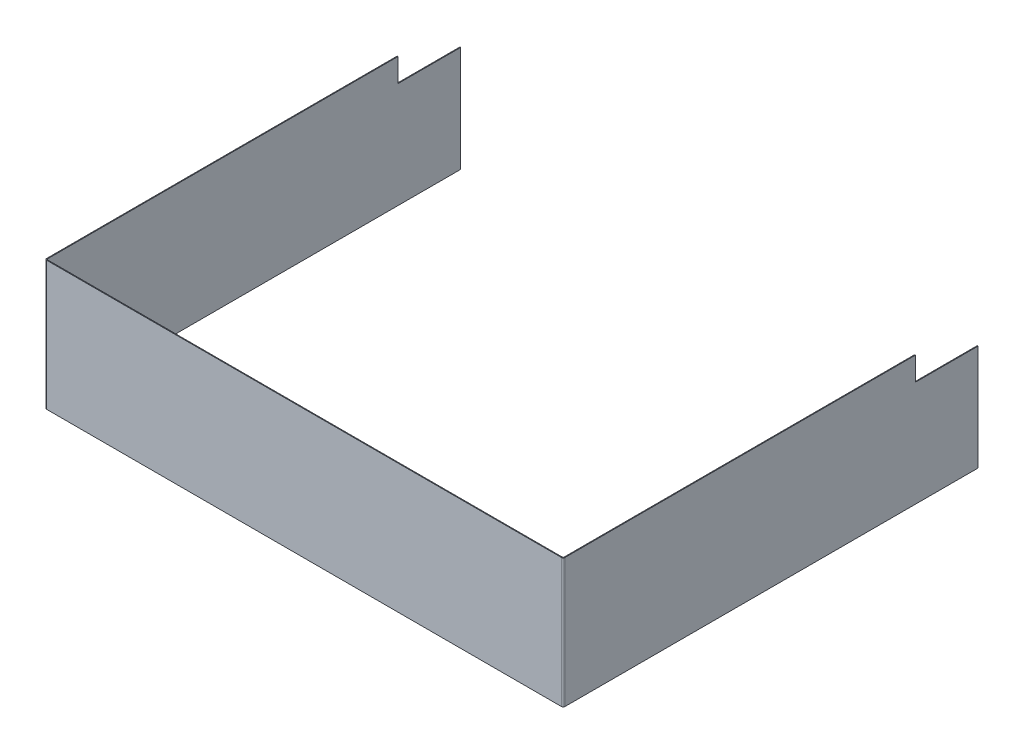
from build123d import *

# Parameters (mm, degrees)
SKETCH1_W                      = 660
SKETCH1_H                      = 165
BASE_FLANGE1_DEPTH             = 1
EDGE_FLANGE1_STRIP_W           = 6
EDGE_FLANGE1_STRIP_H           = 1
EDGE_FLANGE1_STRIP_CUT_DEPTH   = 165
EDGE_FLANGE1_STRIP_2_W         = 6
EDGE_FLANGE1_STRIP_2_H         = 1
EDGE_FLANGE1_STRIP_CUT_2_DEPTH = 165
EDGE_FLANGE1_DEPTH             = 165
EDGE_FLANGE1_BEND_DEPTH        = 165
SKETCH12_W                     = 80
SKETCH12_H                     = 30
CUT_EXTRUDE1_DEPTH             = 853.027141586


# Sheet-metal steps are written as plain solids
with BuildPart() as part:
    # Sketch1 → Base-Flange1 (new body)
    with BuildSketch(Plane.XY):
        Rectangle(SKETCH1_W, SKETCH1_H)
    extrude(amount=-BASE_FLANGE1_DEPTH)

    # Edge-Flange1 strip (across the edge) → Edge-Flange1 strip cut (cut)
    with BuildSketch(Plane(origin=(330, 82.5, -1), x_dir=(-1, 0, 0), z_dir=(0, -1, 0))):
        with Locations((-2, -0.5)):
            Rectangle(EDGE_FLANGE1_STRIP_W, EDGE_FLANGE1_STRIP_H)
    extrude(amount=EDGE_FLANGE1_STRIP_CUT_DEPTH, mode=Mode.SUBTRACT)

    # Edge-Flange1 strip 2 (across the edge) → Edge-Flange1 strip cut 2 (cut)
    with BuildSketch(Plane(origin=(-330, -82.5, -1), x_dir=(1, 0, 0), z_dir=(0, 1, 0))):
        with Locations((-2, -0.5)):
            Rectangle(EDGE_FLANGE1_STRIP_2_W, EDGE_FLANGE1_STRIP_2_H)
    extrude(amount=EDGE_FLANGE1_STRIP_CUT_2_DEPTH, mode=Mode.SUBTRACT)

    # Edge-Flange1 section (across the edge) → Edge-Flange1 (add)
    with BuildSketch(Plane(origin=(330, 82.5, -1), x_dir=(-1, 0, 0), z_dir=(0, -1, 0))):
        with BuildLine():
            Line((-1, 1), (-1, 529))
            Line((-1, 529), (0, 529))
            Line((0, 529), (0, 1))
            ThreePointArc((0, 1), (0.292893219, 0.292893219), (1, 0))
            Line((1, 0), (1, -1))
            ThreePointArc((1, -1), (-0.414213562, -0.414213562), (-1, 1))
        make_face()
    extrude(amount=EDGE_FLANGE1_DEPTH)

    # Edge-Flange1 section 2 (across the edge) → Edge-Flange1 bend (add)
    with BuildSketch(Plane(origin=(-330, -82.5, -1), x_dir=(1, 0, 0), z_dir=(0, 1, 0))):
        with BuildLine():
            Line((-1, 1), (-1, 529))
            Line((-1, 529), (0, 529))
            Line((0, 529), (0, 1))
            ThreePointArc((0, 1), (0.292893219, 0.292893219), (1, 0))
            Line((1, 0), (1, -1))
            ThreePointArc((1, -1), (-0.414213562, -0.414213562), (-1, 1))
        make_face()
    extrude(amount=EDGE_FLANGE1_BEND_DEPTH)

    # Sketch12 → Cut-Extrude1 (cut, through all)
    with BuildSketch(Plane(origin=(331, 0, 0), x_dir=(0, 0, -1), z_dir=(1, 0, 0))):
        with Locations((490, 67.5)):
            Rectangle(SKETCH12_W, SKETCH12_H)
    extrude(amount=-CUT_EXTRUDE1_DEPTH, mode=Mode.SUBTRACT)


solid = part.part
